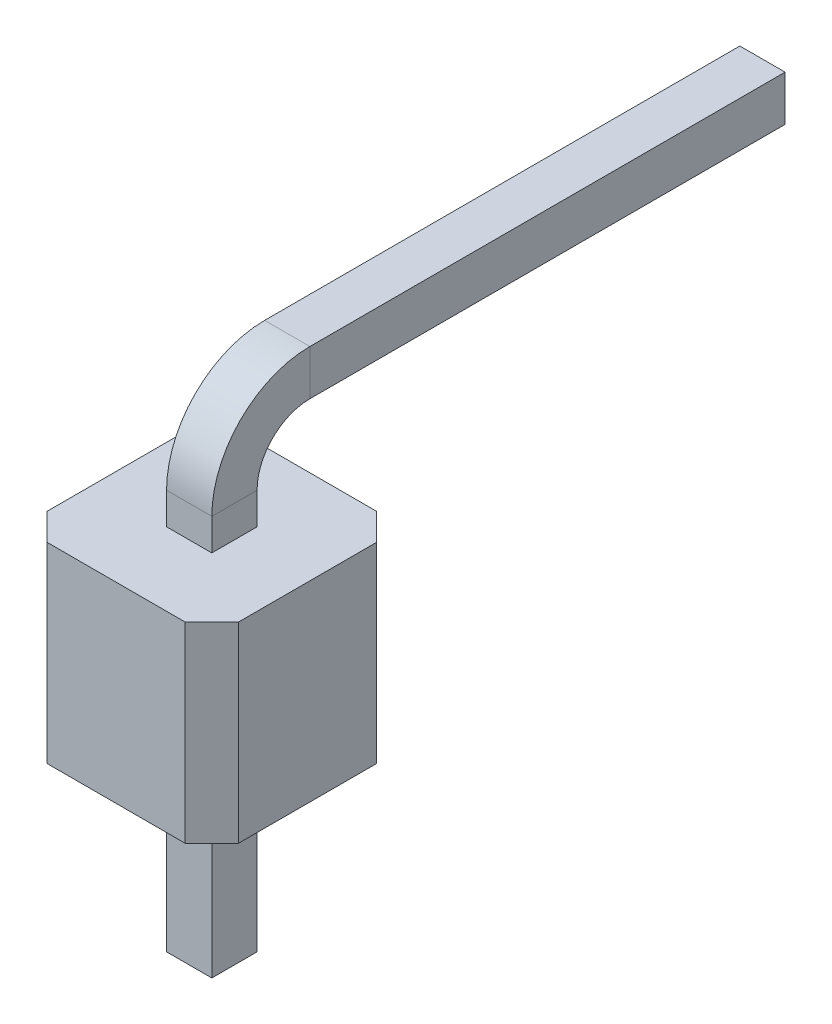
from build123d import *

# Parameters (mm, degrees)
SKETCH3_W           = 0.6
SKETCH3_H           = 0.6
CHAMFER3_SIZE       = 0.2
BOSS_EXTRUDE4_DEPTH = 2.54


with BuildPart() as part:
    # Sweep1: sweep along a path in Sketch5
    with BuildLine(Plane(origin=(0, 0, 0), x_dir=(0, 0, -1), z_dir=(1, 0, 0))) as sweep1_path:
        Line((0, 0), (0, 5.5))
        ThreePointArc((0, 5.5), (0.292893219, 6.207106781), (1, 6.5))
        Line((1, 6.5), (7.5, 6.5))
    # Sketch3 → Sweep1 (sweep)
    with BuildSketch(Plane(origin=(0, 0, 0), x_dir=(1, 0, 0), z_dir=(0, 1, 0))):
        Rectangle(SKETCH3_W, SKETCH3_H)
    sweep(path=sweep1_path.line)

    # Chamfer3
    chamfer3_edges = [part.edges().sort_by_distance(p)[0] for p in [
        (0, 0, 0.3),
        (0.3, 0, 0),
        (0, 0, -0.3),
        (-0.3, 0, 0),
        (0, 6.2, -7.5),
        (0.3, 6.5, -7.5),
        (0, 6.8, -7.5),
        (-0.3, 6.5, -7.5),
    ]]
    chamfer(chamfer3_edges, length=CHAMFER3_SIZE)

    # Sketch2 → Boss-Extrude4 (add)
    with BuildSketch(Plane(origin=(0, 2.54, 0), x_dir=(1, 0, 0), z_dir=(0, 1, 0))):
        Polygon((-0.916446609, 1.27), (-1.27, 0.916446609), (-1.27, -0.916446609), (-0.916446609, -1.27), (0.916446609, -1.27), (1.27, -0.916446609), (1.27, 0.916446609), (0.916446609, 1.27), align=None)
    extrude(amount=BOSS_EXTRUDE4_DEPTH)


solid = part.part
